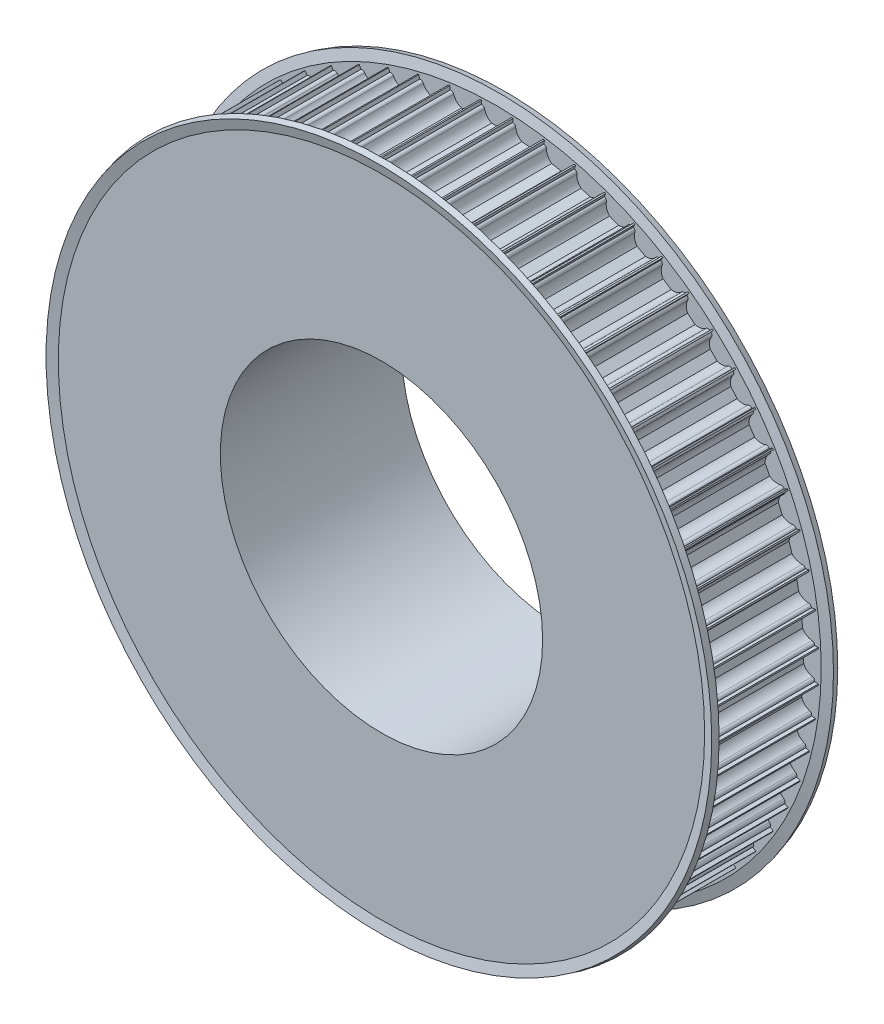
from build123d import *

# Parameters (mm, degrees)
CUT_EXTRUDE1_REACH = 123.758
CIRPATTERN1_COUNT  = 64


with BuildPart() as part:
    # Sketch1 → Revolve1 (revolve)
    with BuildSketch(Plane(origin=(0, 0, 0), x_dir=(0, 0, -1), z_dir=(1, 0, 0)), mode=Mode.PRIVATE) as revolve1_sk:
        Polygon((0, 40), (0, 80), (30, 80), (30, 55.5), (45, 55.5), (45, 40), align=None)
    revolve(revolve1_sk.sketch.rotate(Axis((0, 0, 0), (0, 0, -1)), 90), axis=Axis((0, 0, 0), (0, 0, -1)))

    # Sketch2 → Cut-Extrude1 (cut, up to next)
    with BuildSketch(Plane.XY, mode=Mode.PRIVATE) as cut_extrude1_sk1:
        with BuildLine():
            Line((-3.674234614, 79), (-3.75, 79))
            Line((-3.75, 79), (-3.75, 81))
            Line((-3.75, 81), (3.75, 81))
            Line((3.75, 81), (3.75, 79))
            Line((3.75, 79), (3.674234614, 79))
            ThreePointArc((3.674234614, 79), (3.199892965, 78.830947502), (2.939387691, 78.4))
            ThreePointArc((2.939387691, 78.4), (2.331759211, 77.112435701), (1.198957881, 76.25))
            Line((1.198957881, 76.25), (-1.198957881, 76.25))
            ThreePointArc((-1.198957881, 76.25), (-2.331759211, 77.112435701), (-2.939387691, 78.4))
            ThreePointArc((-2.939387691, 78.4), (-3.199892965, 78.830947502), (-3.674234614, 79))
        make_face()
    cut_extrude1_tool1 = extrude(cut_extrude1_sk1.sketch, amount=-CUT_EXTRUDE1_REACH, mode=Mode.PRIVATE) & part.part
    cut_extrude1 = cut_extrude1_tool1.solids().sort_by_distance((0, 78.935169, 0))[0]
    add(cut_extrude1, mode=Mode.SUBTRACT)

    # CirPattern1: Cut-Extrude1 ×64 about axis
    cirpattern1_axis = Axis((0, 0, 0), (0, 0, 1))
    for i in range(1, CIRPATTERN1_COUNT):
        add(cut_extrude1.rotate(cirpattern1_axis, i * 360 / CIRPATTERN1_COUNT), mode=Mode.SUBTRACT)

    # Sketch3 → Revolve2 (revolve)
    with BuildSketch(Plane(origin=(0, 0, 0), x_dir=(0, 0, -1), z_dir=(1, 0, 0)), mode=Mode.PRIVATE) as revolve2_sk:
        Polygon((30, 55.5), (30, 80.221771432), (30.643078062, 82.621771432), (29.194189322, 83.01), (28.551111261, 80.61), (28.551111261, 55.5), align=None)
        Polygon((1.448888739, 55.5), (0, 55.5), (0, 80.221771432), (-0.643078062, 82.621771432), (0.805810678, 83.01), (1.448888739, 80.61), align=None)
    revolve(revolve2_sk.sketch.rotate(Axis((0, 0, 0), (0, 0, -1)), 90), axis=Axis((0, 0, 0), (0, 0, -1)))


solid = part.part
